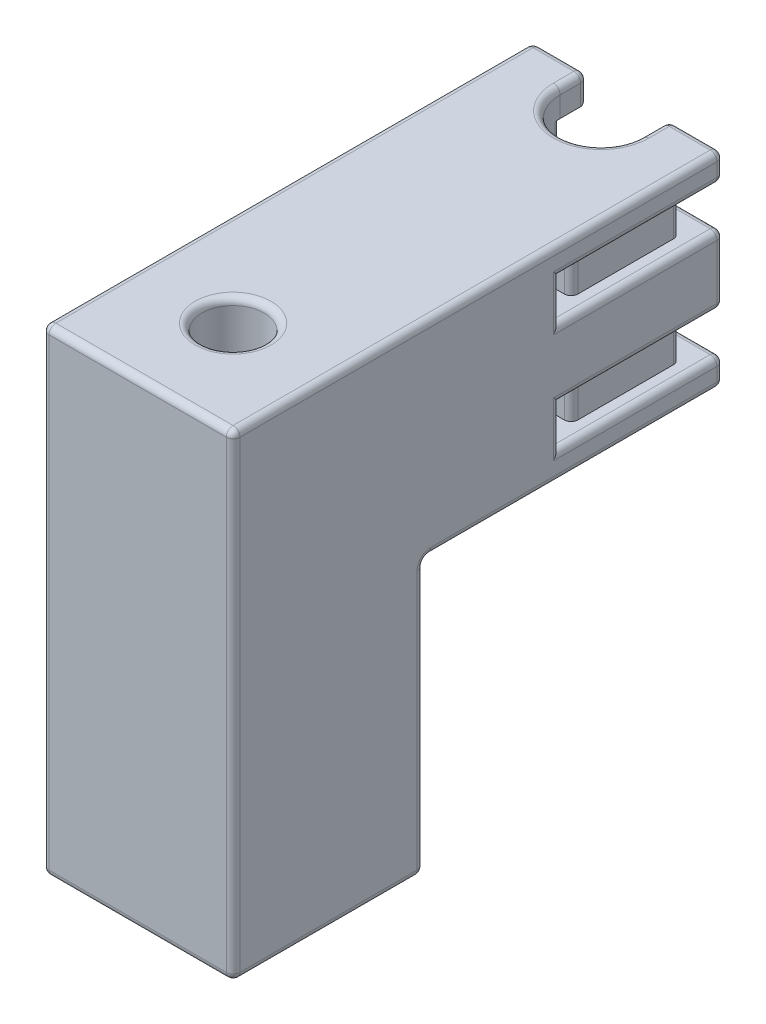
from build123d import *

# Parameters (mm, degrees)
SKETCH1_W               = 14
SKETCH1_H               = 14
BOSS_EXTRUDE1_DEPTH     = 20
SKETCH3_W               = 14
SKETCH3_H               = 36
BOSS_EXTRUDE2_DEPTH     = 15
CUT_EXTRUDE1_DEPTH      = 50.295030175
CUT_EXTRUDE1_DEPTH_BACK = 50.295030175
CUT_EXTRUDE2_DEPTH      = 51.764160586
CUT_EXTRUDE2_DEPTH_BACK = 51.764160586
SKETCH5_W               = 2
SKETCH5_H               = 3
CUT_EXTRUDE3_REACH      = 51.295
SKETCH6_W               = 1.2
SKETCH6_H               = 3
SKETCH7_R               = 3.175
CUT_EXTRUDE4_DEPTH      = 4.699
SKETCH8_R               = 2.286
CUT_EXTRUDE5_DEPTH      = 47.077658371
FILLET1_R               = 0.5
FILLET2_R               = 0.5
DRAFT1_ANGLE            = 4


with BuildPart() as part:
    # Sketch1 → Boss-Extrude1 (new body)
    with BuildSketch(Plane(origin=(0, 0, 0), x_dir=(1, 0, 0), z_dir=(0, 1, 0))):
        with Locations((0, -27)):
            Rectangle(SKETCH1_W, SKETCH1_H)
    extrude(amount=BOSS_EXTRUDE1_DEPTH)

    # Sketch3 → Boss-Extrude2 (add)
    with BuildSketch(Plane(origin=(0, 20, 0), x_dir=(1, 0, 0), z_dir=(0, 1, 0))):
        with Locations((0, -16)):
            Rectangle(SKETCH3_W, SKETCH3_H)
    extrude(amount=BOSS_EXTRUDE2_DEPTH)

    # Sketch4 → Cut-Extrude1 (cut, two sides: drawn at the far end of the back side and taken through both)
    with BuildSketch(Plane(origin=(0, 35, 0), x_dir=(1, 0, 0), z_dir=(0, 1, 0)).offset(-CUT_EXTRUDE1_DEPTH_BACK)):
        with BuildLine():
            Line((-3, 0), (-3, 2))
            Line((-3, 2), (3, 2))
            Line((3, 2), (3, 0))
            ThreePointArc((3, 0), (0, -3), (-3, 0))
        make_face()
    extrude(amount=CUT_EXTRUDE1_DEPTH + CUT_EXTRUDE1_DEPTH_BACK, mode=Mode.SUBTRACT)

    # Sketch5 → Cut-Extrude2 (cut, two sides: drawn at the far end of the back side and taken through both)
    with BuildSketch(Plane(origin=(7, 0, 0), x_dir=(0, 0, -1), z_dir=(1, 0, 0)).offset(-CUT_EXTRUDE2_DEPTH_BACK)):
        with Locations((1, 31.5)):
            Rectangle(SKETCH5_W, SKETCH5_H)
        with Locations((1, 23.5)):
            Rectangle(SKETCH5_W, SKETCH5_H)
        with Locations((-9, 23.5)):
            Rectangle(SKETCH5_W, SKETCH5_H)
        with Locations((-9, 31.5)):
            Rectangle(SKETCH5_W, SKETCH5_H)
    extrude(amount=CUT_EXTRUDE2_DEPTH + CUT_EXTRUDE2_DEPTH_BACK, mode=Mode.SUBTRACT)

    # Sketch6 → Cut-Extrude3 (cut, up to next)
    with BuildSketch(Plane(origin=(0, 0, 0), x_dir=(-1, 0, 0), z_dir=(0, 0, -1)), mode=Mode.PRIVATE) as cut_extrude3_sk1:
        with Locations((-6.4, 31.5)):
            Rectangle(SKETCH6_W, SKETCH6_H)
    cut_extrude3_tool1 = extrude(cut_extrude3_sk1.sketch, amount=-CUT_EXTRUDE3_REACH, mode=Mode.PRIVATE) & part.part
    # Sketch6 → Cut-Extrude3 (cut, up to next)
    with BuildSketch(Plane(origin=(0, 0, 0), x_dir=(-1, 0, 0), z_dir=(0, 0, -1)), mode=Mode.PRIVATE) as cut_extrude3_sk2:
        with Locations((6.4, 31.5)):
            Rectangle(SKETCH6_W, SKETCH6_H)
    cut_extrude3_tool2 = extrude(cut_extrude3_sk2.sketch, amount=-CUT_EXTRUDE3_REACH, mode=Mode.PRIVATE) & part.part
    # Sketch6 → Cut-Extrude3 (cut, up to next)
    with BuildSketch(Plane(origin=(0, 0, 0), x_dir=(-1, 0, 0), z_dir=(0, 0, -1)), mode=Mode.PRIVATE) as cut_extrude3_sk3:
        with Locations((-6.4, 23.5)):
            Rectangle(SKETCH6_W, SKETCH6_H)
    cut_extrude3_tool3 = extrude(cut_extrude3_sk3.sketch, amount=-CUT_EXTRUDE3_REACH, mode=Mode.PRIVATE) & part.part
    # Sketch6 → Cut-Extrude3 (cut, up to next)
    with BuildSketch(Plane(origin=(0, 0, 0), x_dir=(-1, 0, 0), z_dir=(0, 0, -1)), mode=Mode.PRIVATE) as cut_extrude3_sk4:
        with Locations((6.4, 23.5)):
            Rectangle(SKETCH6_W, SKETCH6_H)
    cut_extrude3_tool4 = extrude(cut_extrude3_sk4.sketch, amount=-CUT_EXTRUDE3_REACH, mode=Mode.PRIVATE) & part.part
    add(cut_extrude3_tool1.solids().sort_by_distance((6.4, 31.5, 0))[0], mode=Mode.SUBTRACT)
    add(cut_extrude3_tool2.solids().sort_by_distance((-6.4, 31.5, 0))[0], mode=Mode.SUBTRACT)
    add(cut_extrude3_tool3.solids().sort_by_distance((6.4, 23.5, 0))[0], mode=Mode.SUBTRACT)
    add(cut_extrude3_tool4.solids().sort_by_distance((-6.4, 23.5, 0))[0], mode=Mode.SUBTRACT)

    # Sketch7 → Cut-Extrude4 (cut)
    with BuildSketch(Plane.XZ):
        with Locations(Location((0, 27, 0), (0, 0, 270))):
            Circle(SKETCH7_R)
    extrude(amount=-CUT_EXTRUDE4_DEPTH, mode=Mode.SUBTRACT)

    # Sketch8 → Cut-Extrude5 (cut, through all)
    with BuildSketch(Plane.XZ.offset(-4.699)):
        with Locations(Location((0, 27, 0), (0, 0, 270))):
            Circle(SKETCH8_R)
    extrude(amount=-CUT_EXTRUDE5_DEPTH, mode=Mode.SUBTRACT)

    # Fillet1
    fillet1_edges = [part.edges().sort_by_distance(p)[0] for p in [
        (-5, 33, -2),
        (5, 33, -2),
        (-5, 30, -2),
        (5, 30, -2),
        (-7, 20, 9),
        (-7, 34, -2),
        (7, 20, 9),
        (5, 20, -2),
        (7, 34, -2),
        (-7, 35, 16),
        (0, 35, 34),
        (7, 35, 16),
        (5, 35, -2),
        (0, 35, 29.286),
        (-5, 20, -2),
        (3, 20, -1),
        (0, 20, 3),
        (-3, 20, -1),
        (-5, 35, -2),
        (-3, 35, -1),
        (-3, 21, -2),
        (3, 21, -2),
        (3, 35, -1),
        (0, 35, 3),
        (0, 0, 34),
        (3, 27.5, -2),
        (3, 34, -2),
        (-7, 0, 27),
        (-3, 27.5, -2),
        (-3, 34, -2),
        (0, 0, 20),
        (7, 27.5, -2),
        (7, 21, -2),
        (-7, 27.5, -2),
        (7, 0, 27),
        (-7, 21, -2),
        (-7, 33, 4),
        (7, 17.5, 34),
        (-7, 30, 4),
        (-7, 31.5, 10),
        (-7, 17.5, 34),
        (7, 33, 4),
        (7, 31.5, 10),
        (7, 30, 4),
        (-7, 10, 20),
        (7, 10, 20),
        (-7, 22, 4),
        (-7, 23.5, 10),
        (-7, 25, 4),
        (7, 22, 4),
        (7, 25, 4),
        (7, 23.5, 10),
        (0, 20, 20),
        (-5, 22, -2),
        (5, 22, -2),
        (-5, 25, -2),
        (5, 25, -2),
    ]]
    fillet(fillet1_edges, radius=FILLET1_R)

    # Fillet2
    # the kernel refuses this fillet: 0.5 mm, written as the material it takes off along each edge
    with BuildSketch(Plane(origin=(-3, 30, 0), x_dir=(0.07161243393857297, 0, 0.9974325337111245), z_dir=(0, 1, 0)), Plane(origin=(-3, 22, 0), x_dir=(0.07161243393857297, 0, 0.9974325337111245), z_dir=(0, 1, 0))) as fillet2_piece_1:
        with BuildLine():
            CenterArc((0.465480821, -0.498716267), FILLET2_R, 94.106605351, 81.786789298)
            Line((-0.033235446, -0.46291005), (0, 0))
            ThreePointArc((0, 0), (0.214837302, -0.007702399), (0.429674604, 0))
        make_face()
    extrude(amount=3, mode=Mode.SUBTRACT)
    with BuildSketch(Plane(origin=(-5.8, 33, 8), x_dir=(1, 0, 0), z_dir=(0, -1, 0)), Plane(origin=(-5.8, 30, 0), x_dir=(1, 0, 0), z_dir=(0, 1, 0)), Plane(origin=(5.8, 25, 8), x_dir=(0, 0, -1), z_dir=(0, -1, 0)), Plane(origin=(5.8, 25, 0), x_dir=(-1, 0, 0), z_dir=(0, -1, 0)), Plane(origin=(-5.8, 22, 8), x_dir=(0, 0, -1), z_dir=(0, 1, 0)), Plane(origin=(-5.8, 22, 0), x_dir=(1, 0, 0), z_dir=(0, 1, 0)), Plane(origin=(5.8, 33, 0), x_dir=(-1, 0, 0), z_dir=(0, -1, 0))) as fillet2_piece_2:
        with BuildLine():
            CenterArc((FILLET2_R, -FILLET2_R), FILLET2_R, 90, 90)
            Line((0, -FILLET2_R), (0, 0))
            Line((0, 0), (FILLET2_R, 0))
        make_face()
    extrude(amount=3, mode=Mode.SUBTRACT)
    with BuildSketch(Plane(origin=(5.8, 30, 8), x_dir=(0, 0, -1), z_dir=(0, 1, 0))) as fillet2_piece_3:
        with BuildLine():
            CenterArc((FILLET2_R, FILLET2_R), FILLET2_R, 180, 90)
            Line((0, FILLET2_R), (0, 0))
            Line((0, 0), (FILLET2_R, 0))
        make_face()
    extrude(amount=3, mode=Mode.SUBTRACT)
    with BuildSketch(Plane(origin=(3, 22, 0), x_dir=(-0.07161243393857421, 0, 0.9974325337111244), z_dir=(0, 1, 0)), Plane(origin=(3, 30, 0), x_dir=(-0.07161243393857426, 0, 0.9974325337111244), z_dir=(0, 1, 0))) as fillet2_piece_4:
        with BuildLine():
            CenterArc((0.465480821, 0.498716267), FILLET2_R, 184.106605351, 81.786789298)
            Line((-0.033235446, 0.46291005), (0, 0))
            ThreePointArc((0, 0), (0.214837302, 0.007702399), (0.429674604, 0))
        make_face()
    extrude(amount=3, mode=Mode.SUBTRACT)

    # Draft1
    draft1_faces = [part.faces().sort_by_distance(p)[0] for p in [
        (0, 2.3495, 30.175),
    ]]
    draft(draft1_faces, Plane(origin=(0, 0, 0), x_dir=(0, 0, -1), z_dir=(0, -1, 0)), DRAFT1_ANGLE)


solid = part.part
